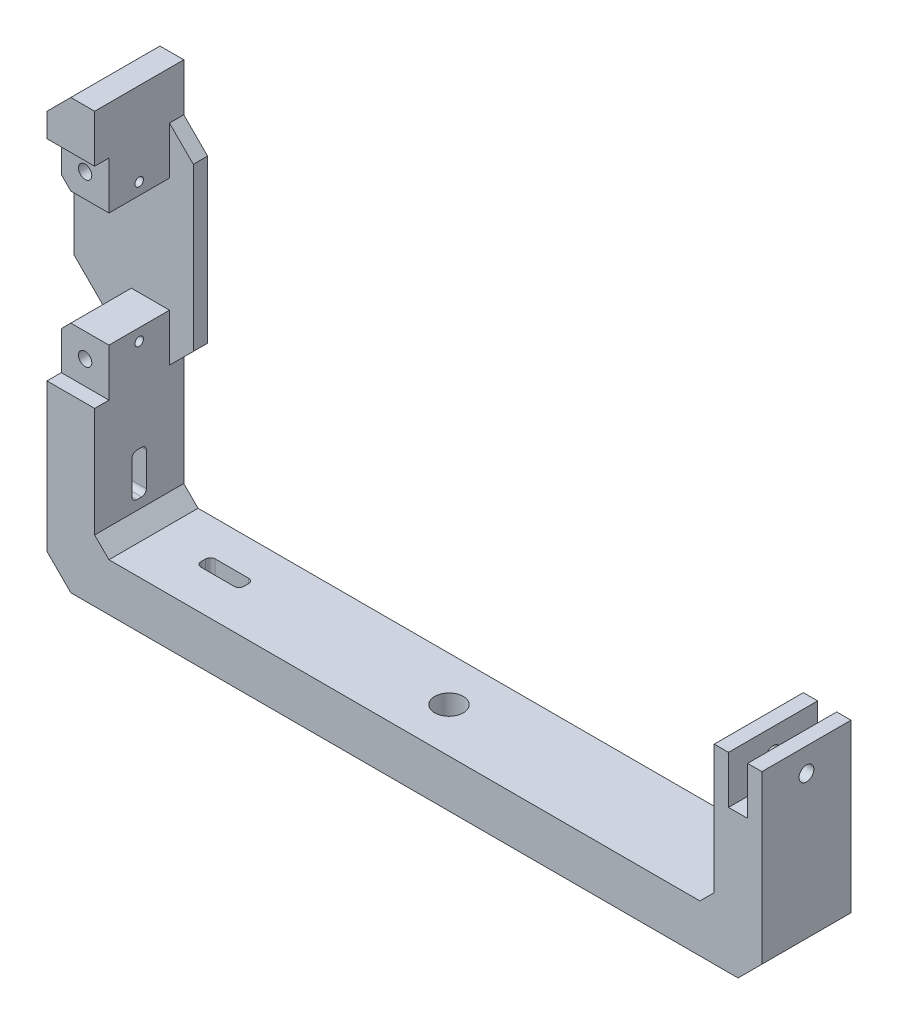
from build123d import *

# Parameters (mm, degrees)
SKETCH1_W           = 150
SKETCH1_H           = 18.7
BOSS_EXTRUDE1_DEPTH = 10
SKETCH2_R           = 3
CUT_EXTRUDE1_DEPTH  = 10
SKETCH3_R           = 0.9
CUT_EXTRUDE2_DEPTH  = 5
SKETCH4_W           = 10
SKETCH4_H           = 18.7
BOSS_EXTRUDE2_DEPTH = 80
SKETCH5_W           = 10
SKETCH5_H           = 24
CUT_EXTRUDE3_DEPTH  = 15.7
SKETCH6_W           = 10
SKETCH6_H           = 24
SKETCH6_W_2         = 5
BOSS_EXTRUDE3_DEPTH = 3
CHAMFER1_SIZE       = 10
CHAMFER2_SIZE       = 2
SKETCH7_W           = 10
SKETCH7_H           = 10
CUT_EXTRUDE4_DEPTH  = 3
SKETCH9_R           = 1.4
CUT_EXTRUDE5_DEPTH  = 10
CUT_EXTRUDE6_DEPTH  = 20
CHAMFER3_SIZE       = 5
CHAMFER4_SIZE       = 5
CHAMFER5_SIZE       = 3
SKETCH11_W          = 9
SKETCH11_H          = 3
CUT_EXTRUDE7_DEPTH  = 20
FILLET1_R           = 1
SKETCH12_W          = 3
SKETCH12_H          = 9
CUT_EXTRUDE8_DEPTH  = 20
FILLET2_R           = 1
SKETCH13_R          = 1.55
CUT_EXTRUDE9_DEPTH  = 20
SKETCH14_R          = 0.9
CUT_EXTRUDE10_DEPTH = 3
CHAMFER6_SIZE       = 2


with BuildPart() as part:
    # Sketch1 → Boss-Extrude1 (new body)
    with BuildSketch(Plane(origin=(0, 0, 0), x_dir=(1, 0, 0), z_dir=(0, 1, 0))):
        Rectangle(SKETCH1_W, SKETCH1_H)
    extrude(amount=BOSS_EXTRUDE1_DEPTH)

    # Sketch2 → Cut-Extrude1 (cut)
    with BuildSketch(Plane(origin=(0, 10, 0), x_dir=(1, 0, 0), z_dir=(0, 1, 0))):
        with Locations(Location((0, 0, 0), (0, 0, 270))):
            Circle(SKETCH2_R)
    extrude(amount=-CUT_EXTRUDE1_DEPTH, mode=Mode.SUBTRACT)

    # Sketch3 → Cut-Extrude2 (cut)
    with BuildSketch(Plane.XZ):
        with Locations(Location((7.25, 0, 0), (0, 0, 270))):
            Circle(SKETCH3_R)
        with Locations(Location((-7.25, 0, 0), (0, 0, 270))):
            Circle(SKETCH3_R)
    extrude(amount=-CUT_EXTRUDE2_DEPTH, mode=Mode.SUBTRACT)

    # Sketch4 → Boss-Extrude2 (add)
    with BuildSketch(Plane(origin=(0, 10, 0), x_dir=(1, 0, 0), z_dir=(0, 1, 0))):
        with Locations((-70, 0)):
            Rectangle(SKETCH4_W, SKETCH4_H)
        with Locations((70, 0)):
            Rectangle(SKETCH4_W, SKETCH4_H)
    extrude(amount=BOSS_EXTRUDE2_DEPTH)

    # Sketch5 → Cut-Extrude3 (cut)
    with BuildSketch(Plane.XY.offset(9.35)):
        with Locations((-70, 58)):
            Rectangle(SKETCH5_W, SKETCH5_H)
    extrude(amount=-CUT_EXTRUDE3_DEPTH, mode=Mode.SUBTRACT)

    # Sketch6 → Boss-Extrude3 (add)
    with BuildSketch(Plane.XY.offset(-6.35)):
        with Locations((-80, 58)):
            Rectangle(SKETCH6_W, SKETCH6_H)
        with Locations((-62.5, 58)):
            Rectangle(SKETCH6_W_2, SKETCH6_H)
    extrude(amount=-BOSS_EXTRUDE3_DEPTH)

    # Chamfer1
    # the kernel refuses this chamfer: 10 mm, written as the material it adds along each edge
    with BuildSketch(Plane(origin=(-75, 70, -6.35), x_dir=(0.027495876610586317, 0.9996219169112968, 0), z_dir=(0, 0, -1))) as chamfer1_piece_1:
        Polygon((CHAMFER1_SIZE * 0.999621916911, -CHAMFER1_SIZE * 0.0274958766106), (-CHAMFER1_SIZE * 0.0274958766106, -CHAMFER1_SIZE * 0.999621916911), (0, 0), align=None)
    extrude(amount=3)
    with BuildSketch(Plane(origin=(-75, 46, -6.35), x_dir=(0.027495876610586317, -0.9996219169112968, 0), z_dir=(0, 0, -1))) as chamfer1_piece_2:
        Polygon((CHAMFER1_SIZE * 0.999621916911, CHAMFER1_SIZE * 0.0274958766106), (-CHAMFER1_SIZE * 0.0274958766106, CHAMFER1_SIZE * 0.999621916911), (0, 0), align=None)
    extrude(amount=3)
    with BuildSketch(Plane(origin=(-65, 46, -6.35), x_dir=(-0.027495876610586317, -0.9996219169112968, 0), z_dir=(0, 0, -1))) as chamfer1_piece_3_section:
        Polygon((CHAMFER1_SIZE * 0.999621916911, -CHAMFER1_SIZE * 0.0274958766106), (-CHAMFER1_SIZE * 0.0274958766106, -CHAMFER1_SIZE * 0.999621916911), (0, 0), align=None)
    chamfer1_piece_3 = extrude(amount=3, mode=Mode.PRIVATE)
    chamfer1_piece_3 = split(chamfer1_piece_3, bisect_by=Plane(origin=(-60, 42.111111111, -7.85), z_dir=(-1, 0, 0)), keep=Keep.TOP, mode=Mode.PRIVATE)
    add(chamfer1_piece_3)
    with BuildSketch(Plane(origin=(-65, 70, -6.35), x_dir=(-0.027495876610586317, 0.9996219169112968, 0), z_dir=(0, 0, -1))) as chamfer1_piece_4_section:
        Polygon((CHAMFER1_SIZE * 0.999621916911, CHAMFER1_SIZE * 0.0274958766106), (-CHAMFER1_SIZE * 0.0274958766106, CHAMFER1_SIZE * 0.999621916911), (0, 0), align=None)
    chamfer1_piece_4 = extrude(amount=3, mode=Mode.PRIVATE)
    chamfer1_piece_4 = split(chamfer1_piece_4, bisect_by=Plane(origin=(-60, 73.888888889, -7.85), z_dir=(-1, 0, 0)), keep=Keep.TOP, mode=Mode.PRIVATE)
    add(chamfer1_piece_4)

    # Chamfer2
    chamfer2_edges = [part.edges().sort_by_distance(p)[0] for p in [
        (-75, 46, 1.5),
    ]]
    chamfer(chamfer2_edges, length=CHAMFER2_SIZE)

    # Sketch7 → Cut-Extrude4 (cut)
    with BuildSketch(Plane.XY.offset(9.35)):
        with Locations((-70, 75)):
            Rectangle(SKETCH7_W, SKETCH7_H)
        with Locations((-70, 41)):
            Rectangle(SKETCH7_W, SKETCH7_H)
    extrude(amount=-CUT_EXTRUDE4_DEPTH, mode=Mode.SUBTRACT)

    # Sketch9 → Cut-Extrude5 (cut)
    with BuildSketch(Plane.XY.offset(6.35)):
        with Locations((-70, 75)):
            Circle(SKETCH9_R)
        with Locations((-70, 41)):
            Circle(SKETCH9_R)
    extrude(amount=-CUT_EXTRUDE5_DEPTH, mode=Mode.SUBTRACT)

    # Sketch10 → Cut-Extrude6 (cut)
    with BuildSketch(Plane.XY.offset(9.35)):
        Polygon((65, 90), (75, 90), (75, 40), (72, 40), (72, 30), (68, 30), (68, 40), (65, 40), align=None)
    extrude(amount=-CUT_EXTRUDE6_DEPTH, mode=Mode.SUBTRACT)

    # Chamfer3
    chamfer3_edges = [part.edges().sort_by_distance(p)[0] for p in [
        (-75, 90, 0),
    ]]
    chamfer(chamfer3_edges, length=CHAMFER3_SIZE)

    # Chamfer4
    chamfer4_edges = [part.edges().sort_by_distance(p)[0] for p in [
        (-75, 0, 0),
        (75, 0, 0),
    ]]
    chamfer(chamfer4_edges, length=CHAMFER4_SIZE)

    # Chamfer5
    chamfer5_edges = [part.edges().sort_by_distance(p)[0] for p in [
        (-65, 10, 0),
        (65, 10, 0),
    ]]
    chamfer(chamfer5_edges, length=CHAMFER5_SIZE)

    # Sketch11 → Cut-Extrude7 (cut)
    with BuildSketch(Plane(origin=(0, 10, 0), x_dir=(1, 0, 0), z_dir=(0, 1, 0))):
        with Locations((-47.5, 0.450329583)):
            Rectangle(SKETCH11_W, SKETCH11_H)
    extrude(amount=-CUT_EXTRUDE7_DEPTH, mode=Mode.SUBTRACT)

    # Fillet1
    fillet1_edges = [part.edges().sort_by_distance(p)[0] for p in [
        (-43, 5, -1.950329583),
        (-43, 5, 1.049670417),
        (-52, 5, 1.049670417),
        (-52, 5, -1.950329583),
    ]]
    fillet(fillet1_edges, radius=FILLET1_R)

    # Sketch12 → Cut-Extrude8 (cut)
    with BuildSketch(Plane(origin=(-65, 0, 0), x_dir=(0, 0, -1), z_dir=(1, 0, 0))):
        with Locations((0, 19.5)):
            Rectangle(SKETCH12_W, SKETCH12_H)
    extrude(amount=-CUT_EXTRUDE8_DEPTH, mode=Mode.SUBTRACT)

    # Fillet2
    fillet2_edges = [part.edges().sort_by_distance(p)[0] for p in [
        (-70, 24, -1.5),
        (-70, 15, -1.5),
        (-70, 15, 1.5),
        (-70, 24, 1.5),
    ]]
    fillet(fillet2_edges, radius=FILLET2_R)

    # Sketch13 → Cut-Extrude9 (cut)
    with BuildSketch(Plane(origin=(75, 0, 0), x_dir=(0, 0, -1), z_dir=(1, 0, 0))):
        with Locations((0, 35)):
            Circle(SKETCH13_R)
    extrude(amount=-CUT_EXTRUDE9_DEPTH, mode=Mode.SUBTRACT)

    # Sketch14 → Cut-Extrude10 (cut)
    with BuildSketch(Plane(origin=(-65, 0, 0), x_dir=(0, 0, -1), z_dir=(1, 0, 0))):
        with Locations((0, 72.5)):
            Circle(SKETCH14_R)
        with Locations((0, 43.5)):
            Circle(SKETCH14_R)
    extrude(amount=-CUT_EXTRUDE10_DEPTH, mode=Mode.SUBTRACT)

    # Chamfer6
    chamfer6_edges = [part.edges().sort_by_distance(p)[0] for p in [
        (-75, 70, 0),
    ]]
    chamfer(chamfer6_edges, length=CHAMFER6_SIZE)


solid = part.part
